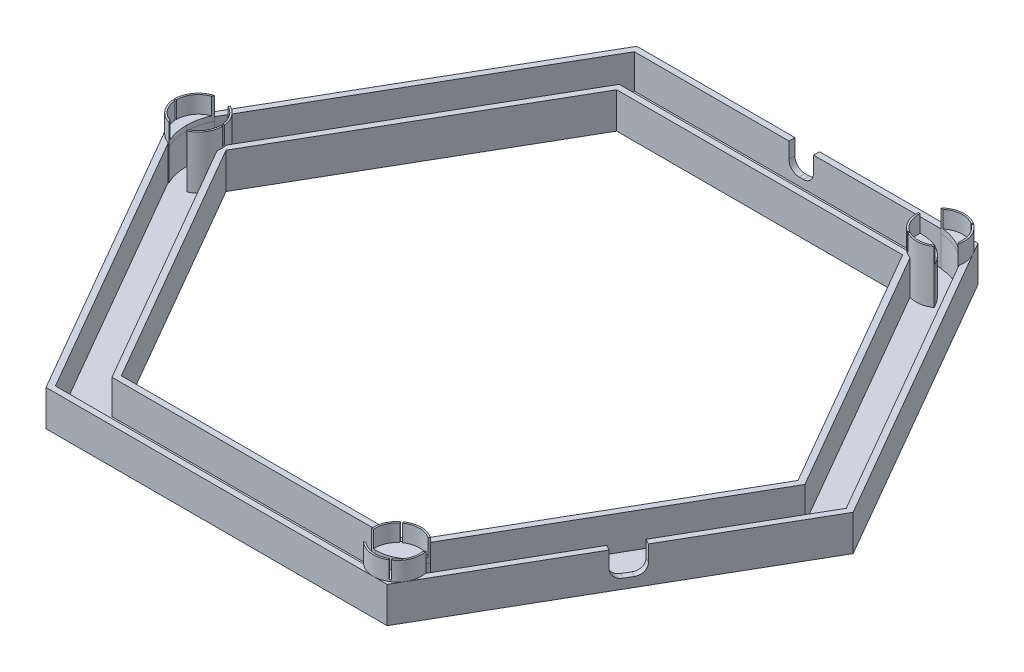
from build123d import *

# Parameters (mm, degrees)
SKETCH1_R            = 7
BOSS_EXTRUDE1_DEPTH  = 0.5
SKETCH1_3_R          = 7
BOSS_EXTRUDE2_DEPTH  = 11
BOSS_EXTRUDE9_DEPTH  = 10
CUT_SWEEP1_START     = 0.5
CUT_SWEEP1_DEPTH     = 10.5
BOSS_EXTRUDE10_DEPTH = 5
CUT_EXTRUDE1_DEPTH   = 3
CUT_EXTRUDE2_DEPTH   = 3


# Read off the part's stored shape, not the designer's step: Cut-Sweep1
with BuildPart() as part:
    # Sketch1 → Boss-Extrude1 (new body)
    with BuildSketch(Plane(origin=(0, 0, 0), x_dir=(1, 0, 0), z_dir=(0, 1, 0))):
        with Locations((45.958548116, 79.602540378)):
            Circle(SKETCH1_R)
        with Locations((-91.917096231, 0)):
            Circle(SKETCH1_R)
        Polygon((50, 86.602540378), (-50, 86.602540378), (-100, 0), (-83.834192463, 0), (-41.917096231, 72.602540378), (41.917096231, 72.602540378), align=None)
        with Locations((45.958548116, -79.602540378)):
            Circle(SKETCH1_R)
        with Locations((-91.917096231, 0)):
            Circle(SKETCH1_R)
        Polygon((41.917096231, -72.602540378), (50, -86.602540378), (-50, -86.602540378), (-100, 0), (-83.834192463, 0), (-41.917096231, -72.602540378), align=None)
        with BuildLine():
            ThreePointArc((-97.979274108, -3.499999913), (-90.105362964, -6.761480797), (-84.917096231, 0))
            Line((-84.917096231, 0), (-98.917096231, 0))
            ThreePointArc((-98.917096231, 0), (-98.678577028, -1.811733267), (-97.979274108, -3.499999913))
        make_face()
        with BuildLine():
            Line((-98.917096231, 0), (-84.917096231, 0))
            ThreePointArc((-84.917096231, 0), (-90.105363649, 6.76148098), (-97.979274817, 3.499998686))
            ThreePointArc((-97.979274817, 3.499998686), (-98.678577212, 1.811732583), (-98.917096231, 0))
        make_face()
        with BuildLine():
            ThreePointArc((-97.979274108, -3.499999913), (-90.105362964, -6.761480797), (-84.917096231, 0))
            Line((-84.917096231, 0), (-98.917096231, 0))
            ThreePointArc((-98.917096231, 0), (-98.678577028, -1.811733267), (-97.979274108, -3.499999913))
        make_face()
        with BuildLine():
            Line((-98.917096231, 0), (-84.917096231, 0))
            ThreePointArc((-84.917096231, 0), (-90.105363649, 6.76148098), (-97.979274817, 3.499998686))
            ThreePointArc((-97.979274817, 3.499998686), (-98.678577212, 1.811732583), (-98.917096231, 0))
        make_face()
        with BuildLine():
            ThreePointArc((42.458548116, -73.540362552), (39.197067327, -81.414273677), (45.95854808, -86.602540378))
            ThreePointArc((45.95854808, -86.602540378), (47.770281414, -86.364021167), (49.458548116, -85.664718205))
            Line((49.458548116, -85.664718205), (42.458548116, -73.540362552))
        make_face()
        with BuildLine():
            ThreePointArc((52.958548116, -79.602540378), (49.458548116, -73.540362552), (42.458548116, -73.540362552))
            Line((42.458548116, -73.540362552), (49.458548116, -85.664718205))
            ThreePointArc((49.458548116, -85.664718205), (50.908295282, -84.552288149), (52.020725515, -83.102541119))
            ThreePointArc((52.020725515, -83.102541119), (52.720028789, -81.414274107), (52.958548116, -79.602540378))
        make_face()
        with BuildLine():
            ThreePointArc((42.458548116, -73.540362552), (39.197067327, -81.414273677), (45.95854808, -86.602540378))
            ThreePointArc((45.95854808, -86.602540378), (47.770281414, -86.364021167), (49.458548116, -85.664718205))
            Line((49.458548116, -85.664718205), (42.458548116, -73.540362552))
        make_face()
        with BuildLine():
            ThreePointArc((52.958548116, -79.602540378), (49.458548116, -73.540362552), (42.458548116, -73.540362552))
            Line((42.458548116, -73.540362552), (49.458548116, -85.664718205))
            ThreePointArc((49.458548116, -85.664718205), (50.908295282, -84.552288149), (52.020725515, -83.102541119))
            ThreePointArc((52.020725515, -83.102541119), (52.720028789, -81.414274107), (52.958548116, -79.602540378))
        make_face()
        with BuildLine():
            ThreePointArc((49.458548116, -85.664718205), (47.770281414, -86.364021167), (45.95854808, -86.602540378))
            Line((45.95854808, -86.602540378), (50, -86.602540378))
            Line((50, -86.602540378), (49.458548116, -85.664718205))
        make_face()
        with BuildLine():
            Line((49.458548116, -85.664718205), (50, -86.602540378))
            Line((50, -86.602540378), (52.020725515, -83.102541119))
            ThreePointArc((52.020725515, -83.102541119), (50.908295282, -84.552288149), (49.458548116, -85.664718205))
        make_face()
        with Locations((45.958548116, 79.602540378)):
            Circle(SKETCH1_R)
        with Locations((45.958548116, -79.602540378)):
            Circle(SKETCH1_R)
        Polygon((41.917096231, 72.602540378), (50, 86.602540378), (100, 0), (50, -86.602540378), (41.917096231, -72.602540378), (83.834192463, 0), align=None)
        with BuildLine():
            Line((50, 86.602540378), (45.958548152, 86.602540378))
            ThreePointArc((45.958548152, 86.602540378), (47.770281449, 86.364021158), (49.458548116, 85.664718205))
            Line((49.458548116, 85.664718205), (50, 86.602540378))
        make_face()
        with BuildLine():
            Line((52.020726965, 83.102538606), (50, 86.602540378))
            Line((50, 86.602540378), (49.458548116, 85.664718205))
            ThreePointArc((49.458548116, 85.664718205), (50.908296308, 84.552287123), (52.020726965, 83.102538606))
        make_face()
        with BuildLine():
            ThreePointArc((49.458548116, 85.664718205), (47.770281449, 86.364021158), (45.958548152, 86.602540378))
            ThreePointArc((45.958548152, 86.602540378), (39.197067336, 81.414273712), (42.458548116, 73.540362552))
            Line((42.458548116, 73.540362552), (49.458548116, 85.664718205))
        make_face()
        with BuildLine():
            Line((49.458548116, 85.664718205), (42.458548116, 73.540362552))
            ThreePointArc((42.458548116, 73.540362552), (49.458548116, 73.540362552), (52.958548116, 79.602540378))
            ThreePointArc((52.958548116, 79.602540378), (52.720029165, 81.414272706), (52.020726965, 83.102538606))
            ThreePointArc((52.020726965, 83.102538606), (50.908296308, 84.552287123), (49.458548116, 85.664718205))
        make_face()
        with BuildLine():
            ThreePointArc((49.458548116, 85.664718205), (47.770281449, 86.364021158), (45.958548152, 86.602540378))
            ThreePointArc((45.958548152, 86.602540378), (39.197067336, 81.414273712), (42.458548116, 73.540362552))
            Line((42.458548116, 73.540362552), (49.458548116, 85.664718205))
        make_face()
        with BuildLine():
            Line((49.458548116, 85.664718205), (42.458548116, 73.540362552))
            ThreePointArc((42.458548116, 73.540362552), (49.458548116, 73.540362552), (52.958548116, 79.602540378))
            ThreePointArc((52.958548116, 79.602540378), (52.720029165, 81.414272706), (52.020726965, 83.102538606))
            ThreePointArc((52.020726965, 83.102538606), (50.908296308, 84.552287123), (49.458548116, 85.664718205))
        make_face()
        with BuildLine():
            Line((-100, 0), (-98.917096231, 0))
            ThreePointArc((-98.917096231, 0), (-98.678577212, 1.811732583), (-97.979274817, 3.499998686))
            Line((-97.979274817, 3.499998686), (-100, 0))
        make_face()
        with BuildLine():
            ThreePointArc((-97.979274108, -3.499999913), (-98.678577028, -1.811733267), (-98.917096231, 0))
            Line((-98.917096231, 0), (-100, 0))
            Line((-100, 0), (-97.979274108, -3.499999913))
        make_face()
    extrude(amount=BOSS_EXTRUDE1_DEPTH)

    # Sketch1<3> → Boss-Extrude2 (add)
    with BuildSketch(Plane(origin=(0, 0, 0), x_dir=(1, 0, 0), z_dir=(0, 1, 0))):
        with Locations(Location((-91.917096231, 0, 0), (0, 0, 150))):
            Circle(SKETCH1_3_R)
        with Locations(Location((45.958548116, -79.602540378, 0), (0, 0, 270))):
            Circle(SKETCH1_3_R)
        with Locations(Location((45.958548116, 79.602540378, 0), (0, 0, 90))):
            Circle(SKETCH1_3_R)
    extrude(amount=BOSS_EXTRUDE2_DEPTH)

    # Sketch2 → Boss-Extrude9 (add)
    # profile 1 of 7: a face of its own
    with BuildSketch(Plane(origin=(0, 0.5, 0), x_dir=(1, 0, 0), z_dir=(0, 1, 0))):
        with BuildLine():
            Line((85.854918405, 0), (43.726947143, 72.967786645))
            ThreePointArc((43.726947143, 72.967786645), (43.078483321, 73.222475584), (42.458548116, 73.540362552))
            ThreePointArc((42.458548116, 73.540362552), (41.873282323, 73.918298705), (41.328483321, 74.352540378))
            Line((41.328483321, 74.352540378), (-42.927459202, 74.352540378))
            Line((-42.927459202, 74.352540378), (-85.055430464, 1.384753733))
            ThreePointArc((-85.055430464, 1.384753733), (-84.917096231, 0), (-85.055430464, -1.384753733))
            Line((-85.055430464, -1.384753733), (-42.927459202, -74.352540378))
            Line((-42.927459202, -74.352540378), (41.328483321, -74.352540378))
            ThreePointArc((41.328483321, -74.352540378), (41.873282323, -73.918298705), (42.458548116, -73.540362552))
            ThreePointArc((42.458548116, -73.540362552), (43.078483321, -73.222475584), (43.726947143, -72.967786645))
            Line((43.726947143, -72.967786645), (85.854918405, 0))
        make_face()
        Polygon((-83.834192463, 0), (-41.917096231, 72.602540378), (41.917096231, 72.602540378), (83.834192463, 0), (41.917096231, -72.602540378), (-41.917096231, -72.602540378), align=None, mode=Mode.SUBTRACT)
    # profile 2 of 7: a face of its own
    with BuildSketch(Plane(origin=(0, 0.5, 0), x_dir=(1, 0, 0), z_dir=(0, 1, 0))):
        with BuildLine():
            ThreePointArc((41.328483321, 84.852540378), (43.483674382, 86.150440805), (45.958548116, 86.602540378))
            Line((45.958548116, 86.602540378), (-50, 86.602540378))
            Line((-50, 86.602540378), (-97.979274058, 3.5))
            ThreePointArc((-97.979274058, 3.5), (-96.350307475, 5.417253738), (-94.148697204, 6.634753733))
            Line((-94.148697204, 6.634753733), (-48.989637029, 84.852540378))
            Line((-48.989637029, 84.852540378), (41.328483321, 84.852540378))
        make_face()
    # profile 3 of 7: a face of its own
    with BuildSketch(Plane(origin=(0, 0.5, 0), x_dir=(1, 0, 0), z_dir=(0, 1, 0))):
        with BuildLine():
            ThreePointArc((-94.148697204, 6.634753733), (-96.350307475, 5.417253738), (-97.979274058, 3.5))
            Line((-97.979274058, 3.5), (-100, 0))
            Line((-100, 0), (-97.979274058, -3.5))
            ThreePointArc((-97.979274058, -3.5), (-96.350307475, -5.417253738), (-94.148697204, -6.634753733))
            Line((-94.148697204, -6.634753733), (-97.979274058, 0))
            Line((-97.979274058, 0), (-94.148697204, 6.634753733))
        make_face()
    # profile 4 of 7: a face of its own
    with BuildSketch(Plane(origin=(0, 0.5, 0), x_dir=(1, 0, 0), z_dir=(0, 1, 0))):
        with BuildLine():
            Line((-50, -86.602540378), (45.958548116, -86.602540378))
            ThreePointArc((45.958548116, -86.602540378), (43.483674382, -86.150440805), (41.328483321, -84.852540378))
            Line((41.328483321, -84.852540378), (-48.989637029, -84.852540378))
            Line((-48.989637029, -84.852540378), (-94.148697204, -6.634753733))
            ThreePointArc((-94.148697204, -6.634753733), (-96.350307475, -5.417253738), (-97.979274058, -3.5))
            Line((-97.979274058, -3.5), (-50, -86.602540378))
        make_face()
    # profile 5 of 7: a face of its own
    with BuildSketch(Plane(origin=(0, 0.5, 0), x_dir=(1, 0, 0), z_dir=(0, 1, 0))):
        with BuildLine():
            Line((50, -86.602540378), (52.020725942, -83.102540378))
            ThreePointArc((52.020725942, -83.102540378), (52.866633094, -80.733187067), (52.820213883, -78.217786645))
            Line((52.820213883, -78.217786645), (48.989637029, -84.852540378))
            Line((48.989637029, -84.852540378), (41.328483321, -84.852540378))
            ThreePointArc((41.328483321, -84.852540378), (43.483674382, -86.150440805), (45.958548116, -86.602540378))
            Line((45.958548116, -86.602540378), (50, -86.602540378))
        make_face()
    # profile 6 of 7: a face of its own
    with BuildSketch(Plane(origin=(0, 0.5, 0), x_dir=(1, 0, 0), z_dir=(0, 1, 0))):
        with BuildLine():
            Line((52.020725942, -83.102540378), (100, 0))
            Line((100, 0), (52.020725942, 83.102540378))
            ThreePointArc((52.020725942, 83.102540378), (52.866633094, 80.733187067), (52.820213883, 78.217786645))
            Line((52.820213883, 78.217786645), (97.979274058, 0))
            Line((97.979274058, 0), (52.820213883, -78.217786645))
            ThreePointArc((52.820213883, -78.217786645), (52.866633094, -80.733187067), (52.020725942, -83.102540378))
        make_face()
    # profile 7 of 7: a face of its own
    with BuildSketch(Plane(origin=(0, 0.5, 0), x_dir=(1, 0, 0), z_dir=(0, 1, 0))):
        with BuildLine():
            ThreePointArc((52.820213883, 78.217786645), (52.866633094, 80.733187067), (52.020725942, 83.102540378))
            Line((52.020725942, 83.102540378), (50, 86.602540378))
            Line((50, 86.602540378), (45.958548116, 86.602540378))
            ThreePointArc((45.958548116, 86.602540378), (43.483674382, 86.150440805), (41.328483321, 84.852540378))
            Line((41.328483321, 84.852540378), (48.989637029, 84.852540378))
            Line((48.989637029, 84.852540378), (52.820213883, 78.217786645))
        make_face()
    extrude(amount=BOSS_EXTRUDE9_DEPTH)

    # Cut-Sweep1 outline → Cut-Sweep1 (cut)
    with BuildSketch(Plane(origin=(0, 0, 0), x_dir=(1, 0, 0), z_dir=(0, 1, 0)).offset(CUT_SWEEP1_START)):
        with BuildLine():
            Line((38.979953336, 80.149545762), (40.185045424, 80.149545762))
            ThreePointArc((40.185045424, 80.149545762), (45.458548116, 78.736514975), (49.31902002, 74.87604307))
            Line((49.31902002, 74.87604307), (49.921566065, 73.832402707))
            ThreePointArc((49.921566065, 73.832402707), (51.719659537, 75.626412211), (52.759213307, 77.943940678))
            ThreePointArc((52.759213307, 77.943940678), (47.729723298, 82.670305783), (41.121826045, 84.662789346))
            ThreePointArc((41.121826045, 84.662789346), (39.634564405, 82.603745139), (38.979953336, 80.149545762))
        make_face()
        with BuildLine():
            Line((49.921566065, -73.832402707), (49.31902002, -74.87604307))
            ThreePointArc((49.31902002, -74.87604307), (45.458548116, -78.736514975), (40.185045424, -80.149545762))
            Line((40.185045424, -80.149545762), (38.979953336, -80.149545762))
            ThreePointArc((38.979953336, -80.149545762), (39.634564405, -82.603745139), (41.121826046, -84.662789345))
            ThreePointArc((41.121826046, -84.662789345), (47.729723298, -82.670305783), (52.759213306, -77.943940678))
            ThreePointArc((52.759213306, -77.943940678), (51.719659537, -75.626412211), (49.921566065, -73.832402707))
        make_face()
        with BuildLine():
            Line((-88.901519399, -6.317143055), (-89.504065444, -5.273502692))
            ThreePointArc((-89.504065444, -5.273502692), (-90.557715738, -2.729765862), (-90.917096231, 0))
            ThreePointArc((-90.917096231, 0), (-90.557715738, 2.729765862), (-89.504065444, 5.273502692))
            Line((-89.504065444, 5.273502692), (-88.901519399, 6.317143055))
            ThreePointArc((-88.901519399, 6.317143055), (-91.35422394, 6.977332928), (-93.881039351, 6.718848668))
            ThreePointArc((-93.881039351, 6.718848668), (-95.05954566, 3.450880209), (-95.459446596, 0))
            ThreePointArc((-95.459446596, 0), (-95.05954566, -3.450880209), (-93.881039351, -6.718848668))
            ThreePointArc((-93.881039351, -6.718848668), (-91.35422394, -6.977332928), (-88.901519399, -6.317143055))
        make_face()
    extrude(amount=CUT_SWEEP1_DEPTH, mode=Mode.SUBTRACT)

    # Sketch5 → Boss-Extrude10 (add)
    with BuildSketch(Plane(origin=(0, 11, 0), x_dir=(1, 0, 0), z_dir=(0, 1, 0))):
        with BuildLine():
            ThreePointArc((41.121826045, -84.662789346), (45.173960153, -86.558431531), (49.546546407, -85.613053523))
            Line((49.546546407, -85.613053523), (49.257916635, -85.202912453))
            ThreePointArc((49.257916635, -85.202912453), (45.438077094, -86.081669171), (41.807496677, -84.604417222))
            ThreePointArc((41.807496677, -84.604417222), (41.464994162, -84.637512547), (41.121826045, -84.662789346))
        make_face()
        with BuildLine():
            ThreePointArc((52.365826248, -78.508562802), (52.565738898, -78.228494586), (52.759213306, -77.943940678))
            ThreePointArc((52.759213306, -77.943940678), (52.511856072, -82.063059598), (49.987113815, -85.327106598))
            Line((49.987113815, -85.327106598), (49.699359122, -84.918209011))
            ThreePointArc((49.699359122, -84.918209011), (51.959949571, -82.099174228), (52.365826248, -78.508562802))
        make_face()
        with BuildLine():
            ThreePointArc((49.921566064, -73.832402708), (45.918631751, -72.602654188), (41.929982416, -73.877974159))
            Line((41.929982416, -73.877974159), (42.217737109, -74.286871746))
            ThreePointArc((42.217737109, -74.286871746), (45.94108332, -73.102563841), (49.670739961, -74.266846262))
            Line((49.670739961, -74.266846262), (49.921566064, -73.832402708))
        make_face()
        with BuildLine():
            Line((41.800725218, -74.60629091), (41.512095446, -74.19614984))
            ThreePointArc((41.512095446, -74.19614984), (39.516991001, -76.862769962), (38.979953335, -80.149545762))
            Line((38.979953335, -80.149545762), (39.481605541, -80.149545762))
            ThreePointArc((39.481605541, -80.149545762), (39.962176067, -77.093851029), (41.800725218, -74.60629091))
        make_face()
        with BuildLine():
            Line((42.867245524, 73.88468691), (42.599900531, 73.460921178))
            ThreePointArc((42.599900531, 73.460921178), (46.313252945, 72.611532977), (49.921566064, 73.832402708))
            Line((49.921566064, 73.832402708), (49.670739961, 74.266846262))
            ThreePointArc((49.670739961, 74.266846262), (46.323085232, 73.11277053), (42.867245524, 73.88468691))
        make_face()
        with BuildLine():
            Line((39.481605541, 80.149545762), (38.979953335, 80.149545762))
            ThreePointArc((38.979953335, 80.149545762), (39.701415902, 76.464340821), (42.223559002, 73.682248466))
            Line((42.223559002, 73.682248466), (42.490343939, 74.10512646))
            ThreePointArc((42.490343939, 74.10512646), (40.139593128, 76.706031644), (39.481605541, 80.149545762))
        make_face()
        with BuildLine():
            ThreePointArc((52.759213306, 77.943940678), (52.526465324, 82.023792854), (50.055348986, 85.278474013))
            Line((50.055348986, 85.278474013), (49.788003994, 84.854708281))
            ThreePointArc((49.788003994, 84.854708281), (51.980679915, 82.048747359), (52.365826248, 78.508562802))
            ThreePointArc((52.365826248, 78.508562802), (52.565738898, 78.228494586), (52.759213306, 77.943940678))
        make_face()
        with BuildLine():
            ThreePointArc((41.807496677, 84.604417222), (41.464994162, 84.637512547), (41.121826045, 84.662789346))
            ThreePointArc((41.121826045, 84.662789346), (45.259711694, 86.567569284), (49.693537229, 85.52283229))
            Line((49.693537229, 85.52283229), (49.426752292, 85.099954297))
            ThreePointArc((49.426752292, 85.099954297), (45.536695838, 86.088836753), (41.807496677, 84.604417222))
        make_face()
        with BuildLine():
            Line((-98.401550079, -0.449286427), (-98.90157143, -0.465946561))
            ThreePointArc((-98.90157143, -0.465946561), (-97.375415001, -4.382551335), (-93.881039351, -6.718848668))
            ThreePointArc((-93.881039351, -6.718848668), (-94.03073306, -6.409017961), (-94.173322925, -6.09585442))
            ThreePointArc((-94.173322925, -6.09585442), (-97.120057562, -3.896048433), (-98.401550079, -0.449286427))
        make_face()
        with BuildLine():
            Line((-89.152345503, -5.8826995), (-88.901519399, -6.317143055))
            ThreePointArc((-88.901519399, -6.317143055), (-85.996410552, -3.734364884), (-84.917096231, 0))
            Line((-84.917096231, 0), (-85.417117582, -0.016660134))
            ThreePointArc((-85.417117582, -0.016660134), (-86.434267849, -3.49121654), (-89.152345503, -5.8826995))
        make_face()
        with BuildLine():
            Line((-84.954269807, 0.720449987), (-85.454321016, 0.694648485))
            ThreePointArc((-85.454321016, 0.694648485), (-86.624103024, 3.772826912), (-89.152345503, 5.8826995))
            Line((-89.152345503, 5.8826995), (-88.901519399, 6.317143055))
            ThreePointArc((-88.901519399, 6.317143055), (-86.196704968, 4.034491764), (-84.954269807, 0.720449987))
        make_face()
        with BuildLine():
            ThreePointArc((-93.881039351, 6.718848668), (-97.518328321, 4.198356712), (-98.917096231, 0))
            Line((-98.917096231, 0), (-98.417045022, 0.025801502))
            ThreePointArc((-98.417045022, 0.025801502), (-97.244294171, 3.724374057), (-94.173322925, 6.09585442))
            ThreePointArc((-94.173322925, 6.09585442), (-94.03073306, 6.409017961), (-93.881039351, 6.718848668))
        make_face()
    extrude(amount=BOSS_EXTRUDE10_DEPTH)

    # Sketch6 → Cut-Extrude1 (cut)
    with BuildSketch(Plane(origin=(75, 0, 43.301270189), x_dir=(0.49999999999999406, 0, -0.8660254037844421), z_dir=(0.866025403784442, 0, 0.499999999999994))):
        with BuildLine():
            Line((-2.392290784, 10.5), (6.056631877, 10.5))
            Line((6.056631877, 10.5), (6.056631877, 5.798001155))
            ThreePointArc((6.056631877, 5.798001155), (5.17795222, 3.676680811), (3.056631877, 2.798001155))
            Line((3.056631877, 2.798001155), (0.607709216, 2.798001155))
            ThreePointArc((0.607709216, 2.798001155), (-1.513611128, 3.676680811), (-2.392290784, 5.798001155))
            Line((-2.392290784, 5.798001155), (-2.392290784, 10.5))
        make_face()
    extrude(amount=-CUT_EXTRUDE1_DEPTH, mode=Mode.SUBTRACT)

    # Sketch7 → Cut-Extrude2 (cut)
    with BuildSketch(Plane.XY.offset(-86.602540378)):
        with BuildLine():
            Line((-3.661362227, 10.5), (3.52679283, 10.5))
            Line((3.52679283, 10.5), (3.52679283, 5.841911445))
            ThreePointArc((3.52679283, 5.841911445), (2.648113174, 3.720591102), (0.52679283, 2.841911445))
            Line((0.52679283, 2.841911445), (-0.661362227, 2.841911445))
            ThreePointArc((-0.661362227, 2.841911445), (-2.782682571, 3.720591102), (-3.661362227, 5.841911445))
            Line((-3.661362227, 5.841911445), (-3.661362227, 10.5))
        make_face()
    extrude(amount=CUT_EXTRUDE2_DEPTH, mode=Mode.SUBTRACT)


solid = part.part
